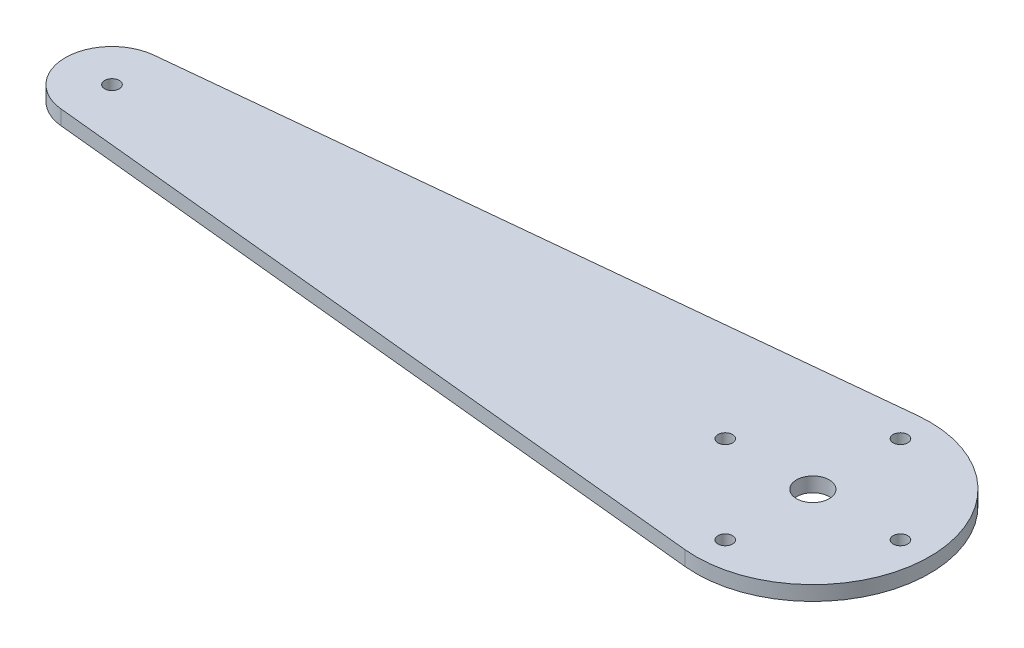
from build123d import *

# Parameters (mm, degrees)
SKETCH1_R           = 1.5875
SKETCH1_R_2         = 3.556
BOSS_EXTRUDE1_DEPTH = 3.175


with BuildPart() as part:
    # Sketch1 → Boss-Extrude1 (new body)
    with BuildSketch(Plane(origin=(0, 0, 0), x_dir=(1, 0, 0), z_dir=(0, 1, 0))):
        with BuildLine():
            Line((-153.416, 10.109072361), (-2.54, 25.272680903))
            ThreePointArc((-2.54, 25.272680903), (25.4, 0), (-2.54, -25.272680903))
            Line((-2.54, -25.272680903), (-153.416, -10.109072361))
            ThreePointArc((-153.416, -10.109072361), (-162.56, 0), (-153.416, 10.109072361))
        make_face()
        with Locations((-152.4, 0)):
            Circle(SKETCH1_R, mode=Mode.SUBTRACT)
        Circle(SKETCH1_R_2, mode=Mode.SUBTRACT)
        with Locations((0, 19.05)):
            Circle(SKETCH1_R, mode=Mode.SUBTRACT)
        with Locations((19.05, 0)):
            Circle(SKETCH1_R, mode=Mode.SUBTRACT)
        with Locations((0, -19.05)):
            Circle(SKETCH1_R, mode=Mode.SUBTRACT)
        with Locations((-19.05, 0)):
            Circle(SKETCH1_R, mode=Mode.SUBTRACT)
    extrude(amount=BOSS_EXTRUDE1_DEPTH)


solid = part.part
